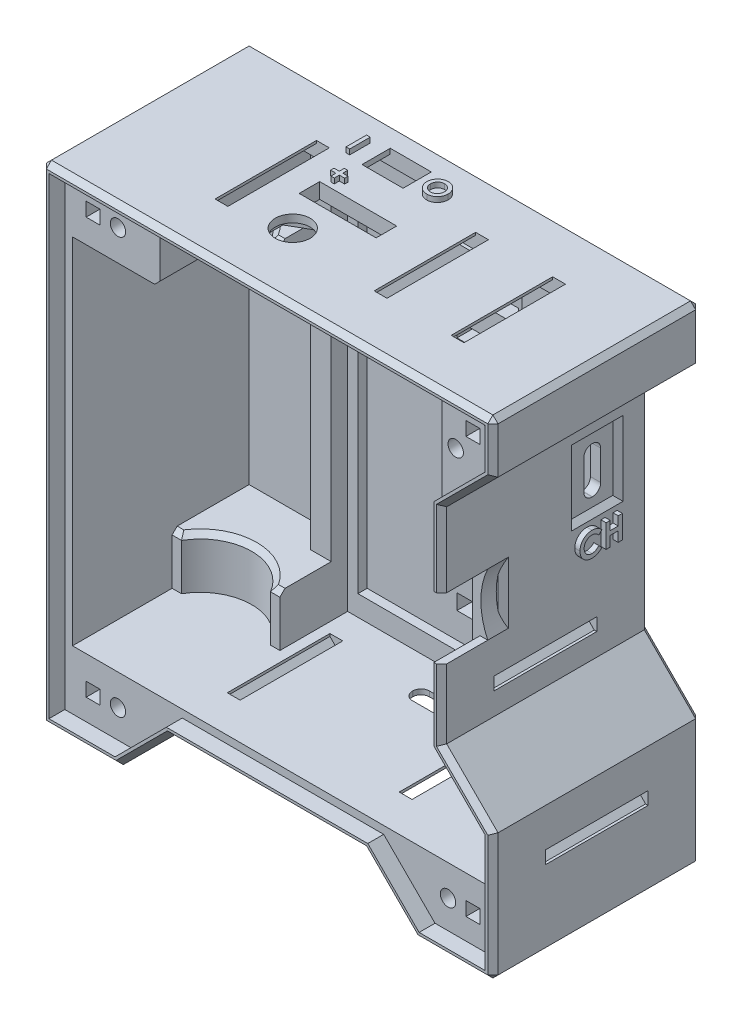
from build123d import *

# Parameters (mm, degrees)
BOSS_EXTRUDE1_DEPTH      = 40.5
CUT_EXTRUDE1_DEPTH       = 37.5
CUT_EXTRUDE2_DEPTH       = 3.1
CUT_EXTRUDE3_DEPTH       = 9
CUT_EXTRUDE4_DEPTH       = 3
SKETCH6_W                = 8
SKETCH6_H                = 12.5
CUT_EXTRUDE5_DEPTH       = 1
SKETCH7_W                = 0.7
SKETCH7_H                = 9
CUT_EXTRUDE6_DEPTH       = 27.25
SKETCH8_W                = 8
SKETCH8_H                = 5.5
SKETCH8_W_2              = 15
SKETCH8_H_2              = 4
CUT_EXTRUDE7_DEPTH       = 3
CHAMFER1_SIZE            = 2
SKETCH9_W                = 17
SKETCH9_H                = 10
BOSS_EXTRUDE2_DEPTH      = 34.4
SKETCH10_W               = 2.7
SKETCH10_H               = 2.7
CUT_EXTRUDE8_DEPTH       = 15
CUT_EXTRUDE9_DEPTH       = 3
SKETCH12_W               = 13
SKETCH12_H               = 7.5
CUT_EXTRUDE10_DEPTH      = 2
SKETCH13_R               = 3.4
CUT_EXTRUDE11_DEPTH      = 3
CUT_EXTRUDE12_DEPTH      = 1.5
CUT_EXTRUDE13_DEPTH      = 3
CHAMFER2_SIZE            = 1
BOSS_EXTRUDE3_DEPTH      = 1.8
SKETCH17_W               = 4
SKETCH17_H               = 79
SKETCH17_W_2             = 3.5
SKETCH17_H_2             = 20.757359313
BOSS_EXTRUDE4_DEPTH      = 5
SKETCH18_W               = 21
SKETCH18_H               = 6
SKETCH18_H_2             = 10
BOSS_EXTRUDE5_DEPTH      = 15
CUT_EXTRUDE14_DEPTH      = 63
CUT_EXTRUDE14_DEPTH_BACK = 6
SKETCH19_R               = 10
SKETCH20_W               = 20
SKETCH20_H               = 5
CUT_EXTRUDE15_DEPTH      = 15
SKETCH21_W               = 5
SKETCH21_H               = 19.763549186
CUT_EXTRUDE16_DEPTH      = 3
SKETCH22_W               = 5
SKETCH22_H               = 20
CUT_EXTRUDE17_DEPTH      = 3
SKETCH24_W               = 20
SKETCH24_H               = 2.5
BOSS_EXTRUDE7_DEPTH      = 1
SKETCH25_W               = 2.5
SKETCH25_H               = 20
BOSS_EXTRUDE8_DEPTH      = 1
SKETCH26_W               = 2.5
SKETCH26_H               = 19.763549186
BOSS_EXTRUDE9_DEPTH      = 1
SKETCH27_W               = 2.5
SKETCH27_H               = 19.763549186
BOSS_EXTRUDE10_DEPTH     = 1
SKETCH28_W               = 2.5
SKETCH28_H               = 20
BOSS_EXTRUDE11_DEPTH     = 1
SKETCH30_W               = 20
SKETCH30_H               = 2.5
BOSS_EXTRUDE13_DEPTH     = 1
CHAMFER3_SIZE            = 0.5
CHAMFER6_SIZE            = 0.5
SKETCH31_W               = 20
SKETCH31_H               = 2.5
BOSS_EXTRUDE14_DEPTH     = 1
SKETCH32_W               = 20
SKETCH32_H               = 2.5
BOSS_EXTRUDE15_DEPTH     = 1
CHAMFER7_SIZE            = 0.5
CHAMFER8_SIZE            = 1.5
SKETCH33_W               = 12
SKETCH33_H               = 3
CUT_EXTRUDE18_DEPTH      = 3
CHAMFER9_SIZE            = 1
SKETCH34_W               = 0.717948718
SKETCH34_H               = 4
BOSS_EXTRUDE16_DEPTH     = 1
BOSS_EXTRUDE17_DEPTH     = 1
BOSS_EXTRUDE18_DEPTH     = 1
BOSS_EXTRUDE19_DEPTH     = 1
SKETCH38_R               = 1.5
CUT_EXTRUDE19_DEPTH      = 21
CHAMFER10_SIZE           = 1
CHAMFER11_SIZE           = 1
CHAMFER12_SIZE           = 1
CHAMFER13_SIZE           = 1
CHAMFER14_SIZE           = 1
SKETCH39_R               = 3
CUT_EXTRUDE20_DEPTH      = 15
SKETCH40_W               = 4
SKETCH40_H               = 10
CUT_EXTRUDE21_DEPTH      = 2
CHAMFER15_SIZE           = 2


# Some blends are built 0.0001 mm under size
with BuildPart() as part:
    # Sketch1 → Boss-Extrude1 (new body)
    with BuildSketch(Plane.XY):
        Polygon((25, 10), (63, 10), (73, 0), (88, 0), (88, 25), (78, 35), (78, 75), (88, 85), (88, 95), (0, 95), (0, 0), (15, 0), align=None)
    extrude(amount=BOSS_EXTRUDE1_DEPTH)

    # Sketch2 → Cut-Extrude1 (cut)
    with BuildSketch(Plane.XY.offset(40.5)):
        Polygon((3, 92), (85, 92), (85, 86.242640687), (75, 76.242640687), (75, 33.757359313), (85, 23.757359313), (85, 3), (74.242640687, 3), (64.242640687, 13), (23.757359313, 13), (13.757359313, 3), (3, 3), align=None)
    extrude(amount=-CUT_EXTRUDE1_DEPTH, mode=Mode.SUBTRACT)

    # Sketch3 → Cut-Extrude2 (cut)
    with BuildSketch(Plane.XY.offset(40.5)):
        Polygon((1.5, 93.5), (86.5, 93.5), (86.5, 85.621320344), (76.5, 75.621320344), (76.5, 34.378679656), (86.5, 24.378679656), (86.5, 1.5), (73.621320344, 1.5), (63.621320344, 11.5), (24.378679656, 11.5), (14.378679656, 1.5), (1.5, 1.5), align=None)
    extrude(amount=-CUT_EXTRUDE2_DEPTH, mode=Mode.SUBTRACT)

    # Sketch4 → Cut-Extrude3 (cut)
    with BuildSketch(Plane.XY.offset(40.5)):
        Polygon((78, 60.5), (76.5, 60.5), (75, 62), (75, 60.5), (75, 47.5), (75, 47), (76.5, 48.5), (78, 48.5), align=None)
    extrude(amount=-CUT_EXTRUDE3_DEPTH, mode=Mode.SUBTRACT)

    # Sketch5 → Cut-Extrude4 (cut)
    with BuildSketch(Plane(origin=(78, 0, 0), x_dir=(0, 0, -1), z_dir=(1, 0, 0))):
        with BuildLine():
            Line((-10.2, 70.5), (-10.1, 70.5))
            ThreePointArc((-10.1, 70.5), (-8.96862915, 70.03137085), (-8.5, 68.9))
            Line((-8.5, 68.9), (-8.5, 63.1))
            ThreePointArc((-8.5, 63.1), (-8.96862915, 61.96862915), (-10.1, 61.5))
            Line((-10.1, 61.5), (-10.2, 61.5))
            ThreePointArc((-10.2, 61.5), (-11.33137085, 61.96862915), (-11.8, 63.1))
            Line((-11.8, 63.1), (-11.8, 68.9))
            ThreePointArc((-11.8, 68.9), (-11.33137085, 70.03137085), (-10.2, 70.5))
        make_face()
    extrude(amount=-CUT_EXTRUDE4_DEPTH, mode=Mode.SUBTRACT)

    # Sketch6 → Cut-Extrude5 (cut)
    with BuildSketch(Plane(origin=(78, 0, 0), x_dir=(0, 0, -1), z_dir=(1, 0, 0))):
        with Locations((-10.15, 66)):
            Rectangle(SKETCH6_W, SKETCH6_H)
    extrude(amount=-CUT_EXTRUDE5_DEPTH, mode=Mode.SUBTRACT)

    # Sketch7 → Cut-Extrude6 (cut)
    with BuildSketch(Plane.XY.offset(37.4)):
        with Locations((75.35, 66)):
            Rectangle(SKETCH7_W, SKETCH7_H)
    extrude(amount=-CUT_EXTRUDE6_DEPTH, mode=Mode.SUBTRACT)

    # Sketch8 → Cut-Extrude7 (cut)
    with BuildSketch(Plane(origin=(0, 95, 0), x_dir=(1, 0, 0), z_dir=(0, 1, 0))):
        with Locations((36, -7.25)):
            Rectangle(SKETCH8_W, SKETCH8_H)
        with Locations((38.25, -19)):
            Rectangle(SKETCH8_W_2, SKETCH8_H_2)
    extrude(amount=-CUT_EXTRUDE7_DEPTH, mode=Mode.SUBTRACT)

    # Chamfer1
    chamfer1_edges = [part.edges().sort_by_distance(p)[0] for p in [
        (32, 92, 7.25),
        (40, 92, 7.25),
        (36, 92, 10),
    ]]
    chamfer(chamfer1_edges, length=CHAMFER1_SIZE)

    # Sketch9 → Boss-Extrude2 (add)
    with BuildSketch(Plane.XY.offset(3)):
        Polygon((75, 76.242640687), (75, 92), (85, 92), (85, 86.242640687), align=None)
        with Locations((11.5, 87)):
            Rectangle(SKETCH9_W, SKETCH9_H)
        Polygon((64.242640687, 13), (85, 13), (85, 3), (74.242640687, 3), align=None)
        Polygon((23.757359313, 13), (3, 13), (3, 3), (13.757359313, 3), align=None)
    extrude(amount=BOSS_EXTRUDE2_DEPTH)

    # Sketch10 → Cut-Extrude8 (cut)
    with BuildSketch(Plane.XY.offset(37.4)):
        with Locations((81, 88)):
            Rectangle(SKETCH10_W, SKETCH10_H)
        with Locations((7, 88)):
            Rectangle(SKETCH10_W, SKETCH10_H)
        with Locations((81, 7)):
            Rectangle(SKETCH10_W, SKETCH10_H)
        with Locations((7, 7)):
            Rectangle(SKETCH10_W, SKETCH10_H)
    extrude(amount=-CUT_EXTRUDE8_DEPTH, mode=Mode.SUBTRACT)

    # Sketch11 → Cut-Extrude9 (cut)
    with BuildSketch(Plane.XZ.offset(-10)):
        with BuildLine():
            Line((45.35, 13.55), (51.15, 13.55))
            ThreePointArc((51.15, 13.55), (52.28137085, 13.08137085), (52.75, 11.95))
            Line((52.75, 11.95), (52.75, 11.85))
            ThreePointArc((52.75, 11.85), (52.28137085, 10.71862915), (51.15, 10.25))
            Line((51.15, 10.25), (45.35, 10.25))
            ThreePointArc((45.35, 10.25), (44.21862915, 10.71862915), (43.75, 11.85))
            Line((43.75, 11.85), (43.75, 11.95))
            ThreePointArc((43.75, 11.95), (44.21862915, 13.08137085), (45.35, 13.55))
        make_face()
    extrude(amount=-CUT_EXTRUDE9_DEPTH, mode=Mode.SUBTRACT)

    # Sketch12 → Cut-Extrude10 (cut)
    with BuildSketch(Plane.XZ.offset(-10)):
        with Locations((48.25, 11.9)):
            Rectangle(SKETCH12_W, SKETCH12_H)
    extrude(amount=-CUT_EXTRUDE10_DEPTH, mode=Mode.SUBTRACT)

    # Sketch13 → Cut-Extrude11 (cut)
    with BuildSketch(Plane(origin=(0, 95, 0), x_dir=(1, 0, 0), z_dir=(0, 1, 0))):
        with Locations(Location((36, -27.5, 0), (0, 0, 270))):
            Circle(SKETCH13_R)
    extrude(amount=-CUT_EXTRUDE11_DEPTH, mode=Mode.SUBTRACT)

    # Sketch14 → Cut-Extrude12 (cut)
    with BuildSketch(Plane.XZ.offset(-92)):
        Polygon((31.5, 24.901923789), (36, 22.303847577), (40.5, 24.901923789), (40.5, 30.098076211), (36, 32.696152423), (31.5, 30.098076211), align=None)
    extrude(amount=-CUT_EXTRUDE12_DEPTH, mode=Mode.SUBTRACT)

    # Sketch15 → Cut-Extrude13 (cut)
    with BuildSketch(Plane.XY.offset(31.5)):
        with BuildLine():
            Line((78, 60.5), (78, 48.5))
            ThreePointArc((78, 48.5), (76.651499661, 54.5), (78, 60.5))
        make_face()
    extrude(amount=-CUT_EXTRUDE13_DEPTH, mode=Mode.SUBTRACT)

    # Chamfer2
    chamfer2_edges = [part.edges().sort_by_distance(p)[0] for p in [
        (78, 54.5, 28.5),
    ]]
    chamfer(chamfer2_edges, length=CHAMFER2_SIZE)

    # Sketch16 → Boss-Extrude3 (add)
    with BuildSketch(Plane.XY.offset(3)):
        Polygon((75, 92), (73, 92), (58, 92), (58, 80), (73, 80), (73, 17), (26, 17), (26, 92), (24, 92), (24, 13), (26, 13), (73, 13), (75, 13), align=None)
    extrude(amount=BOSS_EXTRUDE3_DEPTH)

    # Sketch17 → Boss-Extrude4 (add)
    with BuildSketch(Plane.XY.offset(3)):
        with Locations((22, 52.5)):
            Rectangle(SKETCH17_W, SKETCH17_H)
        with Locations((76.75, 23.378679657)):
            Rectangle(SKETCH17_W_2, SKETCH17_H_2)
    extrude(amount=BOSS_EXTRUDE4_DEPTH)

    # Sketch18 → Boss-Extrude5 (add)
    with BuildSketch(Plane.XY.offset(3)):
        with Locations((13.5, 79)):
            Rectangle(SKETCH18_W, SKETCH18_H)
        with Locations((13.5, 18)):
            Rectangle(SKETCH18_W, SKETCH18_H_2)
    extrude(amount=BOSS_EXTRUDE5_DEPTH)

    # Sketch19 → Cut-Extrude14 (cut, two sides: drawn at the far end of the back side and taken through both)
    with BuildSketch(Plane.XZ.offset(-76).offset(-CUT_EXTRUDE14_DEPTH_BACK)):
        with Locations((13.5, 23)):
            Circle(SKETCH19_R)
    extrude(amount=CUT_EXTRUDE14_DEPTH + CUT_EXTRUDE14_DEPTH_BACK, mode=Mode.SUBTRACT)

    # Sketch20 → Cut-Extrude15 (cut)
    with BuildSketch(Plane(origin=(88, 0, 0), x_dir=(0, 0, -1), z_dir=(1, 0, 0))):
        with Locations((-20.25, 17.5)):
            Rectangle(SKETCH20_W, SKETCH20_H)
        with Locations((-20.25, 41.830736478)):
            Rectangle(SKETCH20_W, SKETCH20_H)
    extrude(amount=-CUT_EXTRUDE15_DEPTH, mode=Mode.SUBTRACT)

    # Sketch21 → Cut-Extrude16 (cut)
    with BuildSketch(Plane(origin=(0, 95, 0), x_dir=(1, 0, 0), z_dir=(0, 1, 0))):
        with Locations((69.5, -20.25)):
            Rectangle(SKETCH21_W, SKETCH21_H)
        with Locations((54.5, -20.25)):
            Rectangle(SKETCH21_W, SKETCH21_H)
        with Locations((23.5, -20.25)):
            Rectangle(SKETCH21_W, SKETCH21_H)
    extrude(amount=-CUT_EXTRUDE16_DEPTH, mode=Mode.SUBTRACT)

    # Sketch22 → Cut-Extrude17 (cut)
    with BuildSketch(Plane.XZ.offset(-10)):
        with Locations((28.5, 20.25)):
            Rectangle(SKETCH22_W, SKETCH22_H)
        with Locations((59.5, 20.25)):
            Rectangle(SKETCH22_W, SKETCH22_H)
    extrude(amount=-CUT_EXTRUDE17_DEPTH, mode=Mode.SUBTRACT)

    # Sketch24 → Boss-Extrude7 (add)
    with BuildSketch(Plane(origin=(88, 0, 0), x_dir=(0, 0, -1), z_dir=(1, 0, 0))):
        with Locations((-20.25, 18.75)):
            Rectangle(SKETCH24_W, SKETCH24_H)
    extrude(amount=-BOSS_EXTRUDE7_DEPTH)

    # Sketch25 → Boss-Extrude8 (add)
    with BuildSketch(Plane.XZ.offset(-10)):
        with Locations((60.75, 20.25)):
            Rectangle(SKETCH25_W, SKETCH25_H)
        with Locations((27.25, 20.25)):
            Rectangle(SKETCH25_W, SKETCH25_H)
    extrude(amount=-BOSS_EXTRUDE8_DEPTH)

    # Sketch26 → Boss-Extrude9 (add)
    with BuildSketch(Plane(origin=(0, 95, 0), x_dir=(1, 0, 0), z_dir=(0, 1, 0))):
        with Locations((22.25, -20.25)):
            Rectangle(SKETCH26_W, SKETCH26_H)
        with Locations((53.25, -20.25)):
            Rectangle(SKETCH26_W, SKETCH26_H)
        with Locations((68.25, -20.25)):
            Rectangle(SKETCH26_W, SKETCH26_H)
    extrude(amount=-BOSS_EXTRUDE9_DEPTH)

    # Sketch27 → Boss-Extrude10 (add)
    with BuildSketch(Plane.XZ.offset(-92)):
        with Locations((24.75, 20.25)):
            Rectangle(SKETCH27_W, SKETCH27_H)
        with Locations((55.75, 20.25)):
            Rectangle(SKETCH27_W, SKETCH27_H)
        with Locations((70.75, 20.25)):
            Rectangle(SKETCH27_W, SKETCH27_H)
    extrude(amount=-BOSS_EXTRUDE10_DEPTH)

    # Sketch28 → Boss-Extrude11 (add)
    with BuildSketch(Plane(origin=(0, 13, 0), x_dir=(1, 0, 0), z_dir=(0, 1, 0))):
        with Locations((29.75, -20.25)):
            Rectangle(SKETCH28_W, SKETCH28_H)
        with Locations((58.25, -20.25)):
            Rectangle(SKETCH28_W, SKETCH28_H)
    extrude(amount=-BOSS_EXTRUDE11_DEPTH)

    # Sketch30 → Boss-Extrude13 (add)
    with BuildSketch(Plane.ZY.offset(-85)):
        with Locations((20.25, 16.25)):
            Rectangle(SKETCH30_W, SKETCH30_H)
    extrude(amount=-BOSS_EXTRUDE13_DEPTH)

    # Chamfer3
    chamfer3_edges = [part.edges().sort_by_distance(p)[0] for p in [
        (54.5, 94, 20.25),
        (69.5, 94, 20.25),
        (54.5, 93, 20.25),
        (69.5, 93, 20.25),
    ]]
    chamfer(chamfer3_edges, length=CHAMFER3_SIZE)

    # Chamfer6
    chamfer6_edges = [part.edges().sort_by_distance(p)[0] for p in [
        (28.5, 11, 20.25),
        (59.5, 11, 20.25),
        (28.5, 12, 20.25),
        (59.5, 12, 20.25),
    ]]
    chamfer(chamfer6_edges, length=CHAMFER6_SIZE)

    # Sketch31 → Boss-Extrude14 (add)
    with BuildSketch(Plane(origin=(78, 0, 0), x_dir=(0, 0, -1), z_dir=(1, 0, 0))):
        with Locations((-20.25, 43.080736478)):
            Rectangle(SKETCH31_W, SKETCH31_H)
    extrude(amount=-BOSS_EXTRUDE14_DEPTH)

    # Sketch32 → Boss-Extrude15 (add)
    with BuildSketch(Plane.ZY.offset(-75)):
        with Locations((20.25, 40.580736478)):
            Rectangle(SKETCH32_W, SKETCH32_H)
    extrude(amount=-BOSS_EXTRUDE15_DEPTH)

    # Chamfer7
    chamfer7_edges = [part.edges().sort_by_distance(p)[0] for p in [
        (87, 17.5, 20.25),
        (23.5, 94, 20.25),
        (23.5, 93, 20.25),
        (86, 17.5, 20.25),
        (77, 41.830736478, 20.25),
        (76, 41.830736478, 20.25),
    ]]
    chamfer(chamfer7_edges, length=CHAMFER7_SIZE)

    # Chamfer8
    chamfer8_edges = [part.edges().sort_by_distance(p)[0] for p in [
        (87, 20, 20.25),
        (26, 11, 20.25),
        (62, 11, 20.25),
        (21, 94, 20.25),
        (52, 94, 20.25),
        (67, 94, 20.25),
        (26, 93, 20.25),
        (57, 93, 20.25),
        (72, 93, 20.25),
        (31, 12, 20.25),
        (57, 12, 20.25),
        (86, 15, 20.25),
        (77, 44.330736478, 20.25),
        (76, 39.330736478, 20.25),
    ]]
    chamfer(chamfer8_edges, length=CHAMFER8_SIZE)

    # Sketch33 → Cut-Extrude18 (cut)
    with BuildSketch(Plane.XY.offset(3)):
        with Locations((49.5, 23.5)):
            Rectangle(SKETCH33_W, SKETCH33_H)
        with Locations((49.5, 31.5)):
            Rectangle(SKETCH33_W, SKETCH33_H)
        with Locations((49.5, 39.5)):
            Rectangle(SKETCH33_W, SKETCH33_H)
        with Locations((49.5, 69.5)):
            Rectangle(SKETCH33_W, SKETCH33_H)
        with Locations((49.5, 77.5)):
            Rectangle(SKETCH33_W, SKETCH33_H)
        with Locations((49.5, 85.5)):
            Rectangle(SKETCH33_W, SKETCH33_H)
    extrude(amount=-CUT_EXTRUDE18_DEPTH, mode=Mode.SUBTRACT)

    # Chamfer9
    chamfer9_edges = [part.edges().sort_by_distance(p)[0] for p in [
        (44, 95, 0),
        (88, 90, 0),
        (20, 5, 40.5),
        (83, 80, 0),
        (78, 55, 0),
        (83, 30, 0),
        (88, 12.5, 0),
        (80.5, 0, 0),
        (68, 5, 0),
        (44, 10, 0),
        (20, 5, 0),
        (7.5, 0, 0),
        (0, 47.5, 0),
        (44, 10, 40.5),
        (78, 67.75, 40.5),
        (0, 95, 20.25),
        (88, 95, 20.25),
        (68, 5, 40.5),
        (88, 0, 20.25),
        (0, 0, 20.25),
        (80.5, 0, 40.5),
        (88, 12.5, 40.5),
        (83, 30, 40.5),
        (78, 41.75, 40.5),
        (83, 80, 40.5),
        (88, 90, 40.5),
        (44, 95, 40.5),
        (0, 47.5, 40.5),
        (7.5, 0, 40.5),
    ]]
    chamfer(chamfer9_edges, length=CHAMFER9_SIZE)

    # Sketch34 → Boss-Extrude16 (add)
    # profile 1 of 2: a face of its own
    with BuildSketch(Plane(origin=(0, 95, 0), x_dir=(1, 0, 0), z_dir=(0, 1, 0))):
        with Locations((28.817356088, -7.57343374)):
            Rectangle(SKETCH34_W, SKETCH34_H)
    # profile 2 of 2: a face of its own
    with BuildSketch(Plane(origin=(0, 95, 0), x_dir=(1, 0, 0), z_dir=(0, 1, 0))):
        with BuildLine():
            add(Edge.make_bspline(
                [(44.28690737, -5.470869638), (44.356452273, -5.47267028), (44.493749661, -5.476225155), (44.695664574, -5.505857815), (44.890246927, -5.554139986), (45.07740873, -5.621255695), (45.256681351, -5.709022778), (45.428697146, -5.81495298), (45.59283996, -5.94104567), (45.747427791, -6.084359314), (45.890294828, -6.240206644), (46.014089199, -6.408004002), (46.119656496, -6.58340359), (46.207150955, -6.766875396), (46.273794271, -6.959690051), (46.320560642, -7.160864453), (46.350605719, -7.370341372), (46.354061365, -7.512966602), (46.355817627, -7.585452971)],
                knots=[0, 0, 0, 0, 1.014329547, 2.002516266, 2.970391464, 3.935626869, 4.897733899, 5.877609409, 6.878433252, 7.912639331, 8.949961323, 9.958554974, 10.949718813, 11.932905612, 12.9188844, 13.919928257, 14.942845884, 16, 16, 16, 16], degree=3))
            add(Edge.make_bspline(
                [(46.355817627, -7.585452971), (46.353947284, -7.657122587), (46.350261713, -7.798349863), (46.321787214, -8.00589637), (46.274233291, -8.204915775), (46.208720298, -8.395858565), (46.122812658, -8.577799878), (46.019304038, -8.751901384), (45.895463041, -8.916547379), (45.755806636, -9.071649508), (45.602057054, -9.212437971), (45.439211839, -9.336507561), (45.268022909, -9.44163945), (45.088740832, -9.527785481), (44.900981144, -9.594640244), (44.705207636, -9.641811136), (44.501432422, -9.670477841), (44.362855394, -9.674139337), (44.292516345, -9.675997843)],
                knots=[0, 0, 0, 0, 1.051557043, 2.072126891, 3.067553643, 4.050577992, 5.02905126, 6.015227836, 7.017913613, 8.04756643, 9.074058332, 10.072836633, 11.047628519, 12.017157415, 12.98668631, 13.966869689, 14.968021931, 16, 16, 16, 16], degree=3))
            add(Edge.make_bspline(
                [(44.292516345, -9.675997843), (44.218950133, -9.674330672), (44.074402582, -9.671054908), (43.862856595, -9.639903892), (43.66017726, -9.592979579), (43.468067201, -9.52294756), (43.28456994, -9.435401647), (43.111033687, -9.327583607), (42.94751676, -9.199671617), (42.794957119, -9.054941551), (42.656737715, -8.896575114), (42.534731979, -8.729275018), (42.431817435, -8.554319287), (42.347990316, -8.371626039), (42.281904383, -8.182330667), (42.235288265, -7.985280309), (42.207751013, -7.780947563), (42.203915233, -7.642160677), (42.201971473, -7.571831176)],
                knots=[0, 0, 0, 0, 1.067978421, 2.098431617, 3.099715153, 4.085208694, 5.062210972, 6.048429807, 7.046490867, 8.072918869, 9.098532598, 10.095778865, 11.076610158, 12.041847152, 13.011192615, 13.984257998, 14.978533688, 16, 16, 16, 16], degree=3))
            add(Edge.make_bspline(
                [(42.201971473, -7.571831176), (42.202581537, -7.52451717), (42.20379394, -7.430488261), (42.218398613, -7.291142218), (42.239425144, -7.154516023), (42.270522385, -7.021154406), (42.308297584, -6.890116563), (42.357240691, -6.762622227), (42.412951192, -6.637309407), (42.478043668, -6.515658206), (42.550420206, -6.398787915), (42.629389454, -6.287249832), (42.715149977, -6.182392617), (42.807425513, -6.083527189), (42.906534056, -5.991303399), (43.011171936, -5.904415692), (43.123368518, -5.825172112), (43.24066817, -5.751637375), (43.362409585, -5.685141187), (43.488097164, -5.62854162), (43.615141496, -5.579114183), (43.74523972, -5.540103864), (43.876997603, -5.508330367), (44.011822711, -5.487318009), (44.148496976, -5.47271374), (44.24066108, -5.471485797), (44.28690737, -5.470869638)],
                knots=[0, 0, 0, 0, 1.034744296, 2.056386356, 3.06226378, 4.057406941, 5.050368692, 6.043467995, 7.042652155, 8.049140477, 9.059438543, 10.048523776, 11.036952808, 12.020949711, 13.004946614, 13.997082645, 14.994316842, 16.007702937, 17.024872941, 18.026463647, 19.021641123, 20.005082605, 20.995858141, 21.984425357, 22.988620895, 24, 24, 24, 24], degree=3))
        make_face()
        with BuildLine():
            add(Edge.make_bspline(
                [(44.275689422, -6.188818356), (44.228885712, -6.190074204), (44.136513917, -6.192552747), (44.001021317, -6.21143589), (43.870943636, -6.241594415), (43.747001946, -6.28527867), (43.628659073, -6.34087764), (43.515705232, -6.408197054), (43.4097046, -6.489550944), (43.309243761, -6.58057178), (43.218493924, -6.681989909), (43.13831358, -6.790676683), (43.071215547, -6.906450596), (43.015020523, -7.028236136), (42.972718125, -7.157402748), (42.942587396, -7.292938658), (42.923545899, -7.4350774), (42.921145695, -7.531973195), (42.919920191, -7.581446561)],
                knots=[0, 0, 0, 0, 1.033739768, 2.040188636, 3.016340934, 3.979330865, 4.937572243, 5.900995986, 6.878200029, 7.884839167, 8.891893314, 9.879764717, 10.863503415, 11.843163062, 12.837761627, 13.859916423, 14.907309254, 16, 16, 16, 16], degree=3))
            add(Edge.make_bspline(
                [(42.919920191, -7.581446561), (42.921545022, -7.63627418), (42.924729422, -7.743727228), (42.947135248, -7.900476839), (42.985469385, -8.04851129), (43.040823133, -8.187106566), (43.109476304, -8.317801663), (43.194732646, -8.438994727), (43.295211411, -8.551411407), (43.372619436, -8.617044946), (43.41190737, -8.650356817)],
                knots=[0, 0, 0, 0, 1.078454662, 2.113592447, 3.107694534, 4.079536787, 5.043276885, 6.005368276, 6.987637804, 8, 8, 8, 8], degree=3))
            add(Edge.make_bspline(
                [(43.41190737, -8.650356817), (43.444091689, -8.674966348), (43.507735207, -8.723630953), (43.609324119, -8.786004627), (43.713940694, -8.839465088), (43.822374396, -8.882660508), (43.934396219, -8.916637299), (44.0499908, -8.940430688), (44.168994352, -8.955363096), (44.249470131, -8.957147802), (44.290112498, -8.958049125)],
                knots=[0, 0, 0, 0, 1.023928204, 2.024787132, 3.009472467, 3.9914905, 4.972207045, 5.96565515, 6.972602802, 8, 8, 8, 8], degree=3))
            add(Edge.make_bspline(
                [(44.290112498, -8.958049125), (44.336111418, -8.956782628), (44.426615738, -8.954290756), (44.55958607, -8.935640075), (44.686975686, -8.904076389), (44.809575433, -8.860775348), (44.927031788, -8.804478285), (45.038770708, -8.735070833), (45.144988103, -8.653405227), (45.245320957, -8.561189088), (45.337029928, -8.459371441), (45.417042952, -8.350104943), (45.486274367, -8.235797062), (45.541300814, -8.114829944), (45.585274484, -7.988345461), (45.615042575, -7.855783441), (45.634244929, -7.717690354), (45.63664581, -7.623713129), (45.637868909, -7.575837587)],
                knots=[0, 0, 0, 0, 1.026359118, 2.019393844, 2.989460624, 3.950973911, 4.916101784, 5.890408035, 6.881132271, 7.902007068, 8.92769091, 9.933912415, 10.920395702, 11.90457117, 12.894218921, 13.903490204, 14.931958862, 16, 16, 16, 16], degree=3))
            add(Edge.make_bspline(
                [(45.637868909, -7.575837587), (45.63660349, -7.528237342), (45.634112707, -7.43454352), (45.6154292, -7.29680547), (45.584065683, -7.164828672), (45.540634613, -7.038397595), (45.485175437, -6.917388288), (45.416594539, -6.802226293), (45.335132561, -6.693022942), (45.242664347, -6.590522415), (45.142018379, -6.496330996), (45.033964875, -6.414589967), (44.921527295, -6.343559611), (44.802125772, -6.287917299), (44.67820316, -6.243587187), (44.549003277, -6.210941856), (44.414036772, -6.192685402), (44.322216267, -6.190118861), (44.275689422, -6.188818356)],
                knots=[0, 0, 0, 0, 1.055025985, 2.07665775, 3.074803781, 4.057872707, 5.035505728, 6.020516407, 7.023567878, 8.050795229, 9.077271434, 10.074415901, 11.050397877, 12.019801805, 12.988065821, 13.964604439, 14.968634123, 16, 16, 16, 16], degree=3))
        make_face(mode=Mode.SUBTRACT)
    extrude(amount=BOSS_EXTRUDE16_DEPTH)

    # Sketch35 → Boss-Extrude17 (add)
    with BuildSketch(Plane(origin=(78, 0, 0), x_dir=(0, 0, -1), z_dir=(1, 0, 0))):
        with BuildLine():
            Line((-10.262415949, 57.004453344), (-10.854663546, 56.438347575))
            add(Edge.make_bspline(
                [(-10.854663546, 56.438347575), (-10.904902812, 56.49029506), (-11.003035838, 56.591764773), (-11.161165073, 56.726101732), (-11.325613719, 56.83805341), (-11.493182758, 56.932338401), (-11.666886269, 57.003671716), (-11.844715768, 57.055653504), (-12.027806748, 57.087344836), (-12.15171568, 57.090970885), (-12.214038546, 57.09279469)],
                knots=[0, 0, 0, 0, 1.115251505, 2.178435587, 3.19620269, 4.182487026, 5.141301733, 6.088180966, 7.038406374, 8, 8, 8, 8], degree=3))
            add(Edge.make_bspline(
                [(-12.214038546, 57.09279469), (-12.266085712, 57.09135382), (-12.36879506, 57.088510422), (-12.519599298, 57.067665509), (-12.663851345, 57.032217827), (-12.802044999, 56.983364355), (-12.933773619, 56.920150556), (-13.059313391, 56.842625354), (-13.178354802, 56.751488913), (-13.289325383, 56.647212778), (-13.390837371, 56.533283263), (-13.480529675, 56.411720743), (-13.555661368, 56.282803711), (-13.617320726, 56.147837742), (-13.665350983, 56.006198149), (-13.69965062, 55.857980287), (-13.719488614, 55.703007642), (-13.722449567, 55.597658393), (-13.723954411, 55.544116805)],
                knots=[0, 0, 0, 0, 1.035432265, 2.043311493, 3.022114605, 3.98653278, 4.95457646, 5.923598177, 6.917315552, 7.932509744, 8.948865224, 9.949768934, 10.933144597, 11.912367597, 12.897413939, 13.903909035, 14.934704909, 16, 16, 16, 16], degree=3))
            add(Edge.make_bspline(
                [(-13.723954411, 55.544116805), (-13.723520732, 55.506537573), (-13.722665942, 55.432468134), (-13.713308756, 55.322898876), (-13.698241481, 55.216590793), (-13.676435399, 55.113704912), (-13.649166681, 55.014152072), (-13.617174264, 54.917073436), (-13.577040249, 54.823810412), (-13.532490886, 54.73327981), (-13.48068049, 54.647951871), (-13.424819326, 54.5665846), (-13.364247014, 54.48957685), (-13.298571223, 54.417243433), (-13.226867648, 54.350714756), (-13.150989562, 54.287990225), (-13.069657007, 54.230640045), (-12.984559464, 54.177224952), (-12.8949618, 54.130822806), (-12.803295007, 54.088791426), (-12.708169231, 54.054655697), (-12.610742686, 54.027139185), (-12.511363539, 54.003740501), (-12.409059771, 53.989333212), (-12.304718228, 53.978422741), (-12.234200858, 53.977749083), (-12.198714026, 53.977410075)],
                knots=[0, 0, 0, 0, 1.103660481, 2.175337485, 3.227646561, 4.255952547, 5.262355991, 6.258840057, 7.255597736, 8.242457506, 9.22035537, 10.185017736, 11.140346927, 12.096287581, 13.051739095, 14.01125915, 14.986044842, 15.97314143, 16.960198552, 17.947847494, 18.933482797, 19.925264591, 20.920966487, 21.929612487, 22.958107872, 24, 24, 24, 24], degree=3))
            add(Edge.make_bspline(
                [(-12.198714026, 53.977410075), (-12.138522262, 53.97915114), (-12.020261096, 53.98257188), (-11.846695832, 54.009321587), (-11.681305426, 54.053323339), (-11.549159284, 54.105286853), (-11.445626271, 54.156601497), (-11.366808119, 54.204065016), (-11.285304007, 54.257158173), (-11.202467649, 54.317884761), (-11.117367299, 54.385516038), (-11.031505175, 54.461533253), (-10.942683192, 54.54343327), (-10.884496791, 54.601886921), (-10.854663546, 54.63185719)],
                knots=[0, 0, 0, 0, 1.404581149, 2.759636711, 4.088442092, 5.392261763, 6.066678138, 6.783632037, 7.538459478, 8.336747902, 9.180226004, 10.074962426, 11.012997595, 12, 12, 12, 12], degree=3))
            Line((-10.854663546, 54.63185719), (-10.280444796, 54.028792286))
            add(Edge.make_bspline(
                [(-10.280444796, 54.028792286), (-10.320809283, 53.989821641), (-10.39959213, 53.913759275), (-10.518433868, 53.805757814), (-10.637126038, 53.708706495), (-10.752801287, 53.619082781), (-10.867354493, 53.539497628), (-10.98077351, 53.469871553), (-11.091774385, 53.408443613), (-11.202662086, 53.356249759), (-11.314126614, 53.311931757), (-11.428810514, 53.273776866), (-11.547064386, 53.2414992), (-11.669610471, 53.215455363), (-11.795305733, 53.194571722), (-11.925326513, 53.180475385), (-12.058848416, 53.170998887), (-12.149418391, 53.170147345), (-12.195108257, 53.169717767)],
                knots=[0, 0, 0, 0, 1.244526981, 2.429050516, 3.560637417, 4.644440555, 5.67424972, 6.652764056, 7.595344123, 8.486817594, 9.369275933, 10.254498637, 11.166417451, 12.086725134, 13.032340136, 13.991389299, 14.986715468, 16, 16, 16, 16], degree=3))
            add(Edge.make_bspline(
                [(-12.195108257, 53.169717767), (-12.279034882, 53.171857224), (-12.443255959, 53.176043547), (-12.683917664, 53.207061364), (-12.912539825, 53.259062188), (-13.129678634, 53.332605696), (-13.335265048, 53.426554081), (-13.529246472, 53.541730389), (-13.711310249, 53.677828616), (-13.879985663, 53.833253558), (-14.032560603, 54.004907358), (-14.167419181, 54.189216447), (-14.278974202, 54.387086638), (-14.37160074, 54.595594756), (-14.444033474, 54.815692304), (-14.495013839, 55.04761736), (-14.526453059, 55.291145986), (-14.529892554, 55.457481652), (-14.531646719, 55.542313921)],
                knots=[0, 0, 0, 0, 1.078019885, 2.10938526, 3.111377082, 4.085535484, 5.04941344, 6.010039228, 6.978205633, 7.964457913, 8.951525778, 9.924444315, 10.892603023, 11.863865945, 12.85144698, 13.863884204, 14.910567087, 16, 16, 16, 16], degree=3))
            add(Edge.make_bspline(
                [(-14.531646719, 55.542313921), (-14.530905494, 55.597640803), (-14.529436567, 55.70728516), (-14.513998009, 55.868800182), (-14.492475761, 56.026248437), (-14.458332672, 56.177995092), (-14.417176546, 56.326084453), (-14.365993496, 56.468906962), (-14.304865268, 56.606873106), (-14.23576217, 56.740213847), (-14.157586526, 56.868055662), (-14.070255749, 56.989300188), (-13.976018075, 57.104883409), (-13.872609125, 57.213271901), (-13.761531568, 57.315417334), (-13.6422839, 57.410766164), (-13.515583336, 57.5006858), (-13.381086946, 57.582857434), (-13.241407636, 57.657186043), (-13.09830713, 57.722747052), (-12.952137009, 57.777540957), (-12.803515293, 57.82299048), (-12.651814057, 57.856915336), (-12.498116107, 57.882595357), (-12.341113658, 57.896950653), (-12.235700114, 57.899300706), (-12.182488065, 57.900486998)],
                knots=[0, 0, 0, 0, 1.071919942, 2.124283339, 3.142214191, 4.149696895, 5.136002878, 6.119640489, 7.086990633, 8.058538607, 9.028339693, 9.988281803, 10.952401235, 11.916291999, 12.888973767, 13.874849856, 14.873389453, 15.898127285, 16.927174885, 17.938320013, 18.946391617, 19.950418109, 20.947802303, 21.956882652, 22.968648068, 24, 24, 24, 24], degree=3))
            add(Edge.make_bspline(
                [(-12.182488065, 57.900486998), (-12.137092731, 57.899806986), (-12.046774047, 57.898454033), (-11.912274371, 57.887175695), (-11.778850361, 57.86946318), (-11.646979715, 57.842738766), (-11.515719159, 57.81101351), (-11.386793605, 57.769473663), (-11.258169183, 57.723169675), (-11.131863174, 57.667822713), (-11.007699275, 57.607406504), (-10.88858622, 57.538862121), (-10.772524113, 57.466407709), (-10.662084819, 57.385755097), (-10.555199574, 57.299829707), (-10.452427288, 57.208230648), (-10.35466985, 57.109430695), (-10.29332271, 57.039622696), (-10.262415949, 57.004453344)],
                knots=[0, 0, 0, 0, 0.996412454, 1.982464992, 2.961075852, 3.949442424, 4.934965278, 5.923860011, 6.921385422, 7.934793307, 8.949617135, 9.951082467, 10.950285876, 11.951772932, 12.951063433, 13.960125323, 14.972308753, 16, 16, 16, 16], degree=3))
        make_face()
        Polygon((-9.454723642, 57.785102382), (-8.647031334, 57.785102382), (-8.647031334, 56.054333152), (-7.089339026, 56.054333152), (-7.089339026, 57.785102382), (-6.281646719, 57.785102382), (-6.281646719, 53.285102382), (-7.089339026, 53.285102382), (-7.089339026, 55.246640844), (-8.647031334, 55.246640844), (-8.647031334, 53.285102382), (-9.454723642, 53.285102382), align=None)
    extrude(amount=BOSS_EXTRUDE17_DEPTH)

    # Sketch36 → Boss-Extrude18 (add)
    with BuildSketch(Plane(origin=(0, 95, 0), x_dir=(1, 0, 0), z_dir=(0, 1, 0))):
        Polygon((31.90912764, -14.331651299), (31.90912764, -13.357292325), (32.575794306, -13.357292325), (32.575794306, -14.331651299), (33.601435332, -14.331651299), (33.601435332, -14.998317966), (32.575794306, -14.998317966), (32.575794306, -15.97267694), (31.90912764, -15.97267694), (31.90912764, -14.998317966), (30.883486614, -14.998317966), (30.883486614, -14.331651299), align=None)
    extrude(amount=BOSS_EXTRUDE18_DEPTH)

    # Sketch37 → Boss-Extrude19 (add)
    # profile 1 of 2: a face of its own
    with BuildSketch(Plane.XZ.offset(-10)):
        with BuildLine():
            Line((44.782448013, 22.160822962), (45.583730064, 22.160822962))
            add(Edge.make_bspline(
                [(45.583730064, 22.160822962), (45.636084794, 22.160588611), (45.737088042, 22.160136499), (45.882743035, 22.154654039), (46.017116898, 22.144829137), (46.140178759, 22.132687112), (46.251878017, 22.115664465), (46.352354553, 22.096149334), (46.44162922, 22.072374223), (46.52070872, 22.044153497), (46.591680018, 22.010882364), (46.658841756, 21.975446232), (46.720676071, 21.933154458), (46.780303929, 21.88856507), (46.834316301, 21.837418461), (46.886082804, 21.783118512), (46.933410983, 21.723511731), (46.976520142, 21.659319644), (47.015626791, 21.591728244), (47.049792976, 21.520616699), (47.077506672, 21.445872482), (47.100755017, 21.367979103), (47.119428314, 21.286939957), (47.131857855, 21.202256646), (47.140300625, 21.11452046), (47.141045583, 21.054807158), (47.141422372, 21.024605013)],
                knots=[0, 0, 0, 0, 1.698747864, 3.27724071, 4.728299578, 6.070144658, 7.288476769, 8.393259625, 9.389771311, 10.283485332, 11.113357557, 11.931608583, 12.74405601, 13.541433047, 14.344816069, 15.154114104, 15.974336324, 16.810834471, 17.661136416, 18.50621059, 19.367396281, 20.244825668, 21.142564693, 22.063065223, 23.020325768, 24, 24, 24, 24], degree=3))
            add(Edge.make_bspline(
                [(47.141422372, 21.024605013), (47.140877205, 20.991193099), (47.139805886, 20.925534584), (47.129303501, 20.829287255), (47.111362111, 20.737524141), (47.087913651, 20.649471387), (47.055216443, 20.566577657), (47.017861417, 20.486865079), (46.971902887, 20.412568551), (46.919387919, 20.342758712), (46.862035583, 20.276867975), (46.798484337, 20.216798811), (46.729945495, 20.16214173), (46.656815803, 20.112323922), (46.578820711, 20.06744588), (46.496016497, 20.02708737), (46.407837726, 19.992539181), (46.346432682, 19.974470758), (46.315300577, 19.965310141)],
                knots=[0, 0, 0, 0, 1.102006807, 2.165578795, 3.188629044, 4.184801286, 5.166646146, 6.124351954, 7.085497154, 8.042432466, 9.003981491, 9.963833307, 10.922997304, 11.89326795, 12.880200226, 13.889073926, 14.929769137, 16, 16, 16, 16], degree=3))
            add(Edge.make_bspline(
                [(46.315300577, 19.965310141), (46.294795182, 19.960208366), (46.250373892, 19.949156277), (46.176868859, 19.937935633), (46.092162026, 19.927618941), (45.995979481, 19.918752993), (45.888265772, 19.912726214), (45.769125193, 19.908019568), (45.638503754, 19.90459735), (45.54767477, 19.904475914), (45.500396731, 19.904412705)],
                knots=[0, 0, 0, 0, 0.618981996, 1.340914327, 2.176866532, 3.120127938, 4.170906482, 5.338178032, 6.614476169, 8, 8, 8, 8], degree=3))
            Line((45.500396731, 19.904412705), (45.500396731, 18.160822962))
            Line((45.500396731, 18.160822962), (44.782448013, 18.160822962))
            Line((44.782448013, 18.160822962), (44.782448013, 22.160822962))
        make_face()
        with BuildLine():
            Line((45.500396731, 20.622361423), (45.754403141, 20.622361423))
            add(Edge.make_bspline(
                [(45.754403141, 20.622361423), (45.800623618, 20.622654497), (45.885669981, 20.623193757), (46.001813281, 20.630991769), (46.095148271, 20.642900909), (46.168884646, 20.65998137), (46.227106498, 20.685903232), (46.277319201, 20.715889944), (46.320387918, 20.753807318), (46.357679087, 20.797134406), (46.387492254, 20.846919402), (46.408166132, 20.902351653), (46.421595477, 20.962266469), (46.422835801, 21.003963216), (46.423473654, 21.025406295)],
                knots=[0, 0, 0, 0, 1.8619151, 3.425951444, 4.686033666, 5.651700536, 6.461346321, 7.243864085, 7.999046032, 8.762387399, 9.539336099, 10.322741239, 11.137448474, 12, 12, 12, 12], degree=3))
            add(Edge.make_bspline(
                [(46.423473654, 21.025406295), (46.422842363, 21.044140834), (46.421617505, 21.080490344), (46.41261937, 21.132951703), (46.398278932, 21.181856512), (46.377500187, 21.226694024), (46.350638191, 21.267388055), (46.317887982, 21.303922572), (46.279669809, 21.337079995), (46.250163145, 21.354630725), (46.235172372, 21.363547321)],
                knots=[0, 0, 0, 0, 1.102301479, 2.1387299, 3.123554645, 4.094223062, 5.036071848, 5.982632524, 6.975082478, 8, 8, 8, 8], degree=3))
            add(Edge.make_bspline(
                [(46.235172372, 21.363547321), (46.222474322, 21.369969088), (46.195589949, 21.383565287), (46.149803255, 21.399371862), (46.096966109, 21.412706449), (46.036721801, 21.423774028), (45.969310662, 21.432363618), (45.894744721, 21.438932506), (45.812914247, 21.441574111), (45.756006048, 21.442428913), (45.726358269, 21.442874244)],
                knots=[0, 0, 0, 0, 0.656809284, 1.390599849, 2.23162475, 3.173112763, 4.218524733, 5.370385145, 6.63003504, 8, 8, 8, 8], degree=3))
            Line((45.726358269, 21.442874244), (45.500396731, 21.442874244))
            Line((45.500396731, 21.442874244), (45.500396731, 20.622361423))
        make_face(mode=Mode.SUBTRACT)
    # profile 2 of 2: a face of its own
    with BuildSketch(Plane.XZ.offset(-10)):
        with BuildLine():
            Line((51.44911468, 21.466912705), (50.922672372, 20.963707577))
            add(Edge.make_bspline(
                [(50.922672372, 20.963707577), (50.878015247, 21.009883119), (50.79078589, 21.10007842), (50.65022657, 21.21948905), (50.504049995, 21.319001653), (50.355099739, 21.402810533), (50.200696618, 21.466217925), (50.042625952, 21.512423959), (49.879878415, 21.540594031), (49.769737141, 21.543817186), (49.714339039, 21.545438346)],
                knots=[0, 0, 0, 0, 1.115251505, 2.178435587, 3.19620269, 4.182487026, 5.141301733, 6.088180966, 7.038406374, 8, 8, 8, 8], degree=3))
            add(Edge.make_bspline(
                [(49.714339039, 21.545438346), (49.668074891, 21.544157573), (49.576777693, 21.541630108), (49.442729481, 21.523101296), (49.314505439, 21.491592246), (49.191666636, 21.448166938), (49.074574529, 21.391976893), (48.96298362, 21.323065603), (48.857169033, 21.242055434), (48.758528516, 21.149365535), (48.668295639, 21.048094856), (48.588569145, 20.940039283), (48.521785419, 20.825446365), (48.4669771, 20.705476615), (48.424283539, 20.579574754), (48.393794972, 20.447825544), (48.3761612, 20.310072082), (48.373529242, 20.216428305), (48.372191603, 20.168835782)],
                knots=[0, 0, 0, 0, 1.035432265, 2.043311493, 3.022114605, 3.98653278, 4.95457646, 5.923598177, 6.917315552, 7.932509744, 8.948865224, 9.949768934, 10.933144597, 11.912367597, 12.897413939, 13.903909035, 14.934704909, 16, 16, 16, 16], degree=3))
            add(Edge.make_bspline(
                [(48.372191603, 20.168835782), (48.372577095, 20.13543202), (48.373336908, 20.069592519), (48.381654407, 19.972197623), (48.395047541, 19.877701549), (48.414430724, 19.786247432), (48.438669585, 19.697756019), (48.467107289, 19.611463898), (48.502781969, 19.528563432), (48.542381403, 19.448091786), (48.588435088, 19.372244729), (48.638089456, 19.299918266), (48.691931511, 19.231466933), (48.750309992, 19.167170562), (48.814046503, 19.108033961), (48.88149369, 19.052278821), (48.953789296, 19.001300884), (49.029431555, 18.953820801), (49.109073923, 18.912574449), (49.190555517, 18.875213223), (49.275111763, 18.844870352), (49.361713136, 18.820411231), (49.450050155, 18.7996124), (49.540986838, 18.786805921), (49.633734877, 18.777107725), (49.696416983, 18.776508918), (49.727960833, 18.776207577)],
                knots=[0, 0, 0, 0, 1.103660481, 2.175337485, 3.227646561, 4.255952547, 5.262355991, 6.258840057, 7.255597736, 8.242457506, 9.22035537, 10.185017736, 11.140346927, 12.096287581, 13.051739095, 14.01125915, 14.986044842, 15.97314143, 16.960198552, 17.947847494, 18.933482797, 19.925264591, 20.920966487, 21.929612487, 22.958107872, 24, 24, 24, 24], degree=3))
            add(Edge.make_bspline(
                [(49.727960833, 18.776207577), (49.781464624, 18.777755191), (49.88658566, 18.780795849), (50.040865895, 18.804573365), (50.187879589, 18.843686035), (50.305342827, 18.889875824), (50.397372171, 18.935488841), (50.467432751, 18.977678636), (50.53988085, 19.024872553), (50.613513169, 19.078851743), (50.689157925, 19.138968433), (50.765479812, 19.206539291), (50.844432687, 19.279339306), (50.896153932, 19.331298107), (50.922672372, 19.357938346)],
                knots=[0, 0, 0, 0, 1.404581149, 2.759636711, 4.088442092, 5.392261763, 6.066678138, 6.783632037, 7.538459478, 8.336747902, 9.180226004, 10.074962426, 11.012997595, 12, 12, 12, 12], degree=3))
            Line((50.922672372, 19.357938346), (51.433089039, 18.821880654))
            add(Edge.make_bspline(
                [(51.433089039, 18.821880654), (51.397209494, 18.78724008), (51.327180297, 18.719629089), (51.221543197, 18.62362779), (51.116039045, 18.537359951), (51.013216602, 18.457694427), (50.91139153, 18.386952068), (50.810574625, 18.325062224), (50.711907181, 18.270459611), (50.613340336, 18.224065075), (50.514260756, 18.184671295), (50.412319511, 18.150755836), (50.307204958, 18.122064577), (50.198275105, 18.0989145), (50.086545983, 18.080351264), (49.970971956, 18.067821186), (49.852285821, 18.059397632), (49.771779176, 18.058640706), (49.731165962, 18.058258859)],
                knots=[0, 0, 0, 0, 1.244526981, 2.429050516, 3.560637417, 4.644440555, 5.67424972, 6.652764056, 7.595344123, 8.486817594, 9.369275933, 10.254498637, 11.166417451, 12.086725134, 13.032340136, 13.991389299, 14.986715468, 16, 16, 16, 16], degree=3))
            add(Edge.make_bspline(
                [(49.731165962, 18.058258859), (49.656564517, 18.060160599), (49.510590227, 18.063881774), (49.296668711, 18.091453167), (49.093449013, 18.137676122), (48.900436738, 18.203048129), (48.717693258, 18.286557805), (48.545265327, 18.388936746), (48.383430858, 18.509912947), (48.233497156, 18.648068451), (48.097874987, 18.800649606), (47.978000696, 18.964479908), (47.878840677, 19.140364523), (47.796505977, 19.325705072), (47.732121325, 19.521347336), (47.686805444, 19.727502942), (47.658859472, 19.943972832), (47.655802142, 20.091826757), (47.654242885, 20.167233218)],
                knots=[0, 0, 0, 0, 1.078019885, 2.10938526, 3.111377082, 4.085535484, 5.04941344, 6.010039228, 6.978205633, 7.964457913, 8.951525778, 9.924444315, 10.892603023, 11.863865945, 12.85144698, 13.863884204, 14.910567087, 16, 16, 16, 16], degree=3))
            add(Edge.make_bspline(
                [(47.654242885, 20.167233218), (47.654901751, 20.216412669), (47.656207464, 20.31387432), (47.669930627, 20.457443228), (47.689061514, 20.597397232), (47.719410926, 20.732283148), (47.755994149, 20.863918135), (47.801490194, 20.990871477), (47.855826396, 21.113508049), (47.917251373, 21.232033153), (47.986740834, 21.345670321), (48.064368191, 21.453443233), (48.148135013, 21.556183874), (48.240054079, 21.6525292), (48.338789686, 21.743325141), (48.444787613, 21.828079657), (48.557410336, 21.908008222), (48.676962682, 21.981049674), (48.801122069, 22.047119549), (48.928322519, 22.105396001), (49.058251516, 22.154101695), (49.190359708, 22.194501271), (49.325205251, 22.224656698), (49.46182565, 22.247483383), (49.601383383, 22.260243647), (49.695084311, 22.262332583), (49.74238391, 22.263387064)],
                knots=[0, 0, 0, 0, 1.071919942, 2.124283339, 3.142214191, 4.149696895, 5.136002878, 6.119640489, 7.086990633, 8.058538607, 9.028339693, 9.988281803, 10.952401235, 11.916291999, 12.888973767, 13.874849856, 14.873389453, 15.898127285, 16.927174885, 17.938320013, 18.946391617, 19.950418109, 20.947802303, 21.956882652, 22.968648068, 24, 24, 24, 24], degree=3))
            add(Edge.make_bspline(
                [(49.74238391, 22.263387064), (49.782735319, 22.262782609), (49.863018593, 22.261579984), (49.98257386, 22.251554795), (50.101172981, 22.235810337), (50.218391333, 22.212055303), (50.335067382, 22.183855075), (50.449667874, 22.146930767), (50.564000695, 22.105771667), (50.676272702, 22.056574367), (50.786640613, 22.00287107), (50.892518883, 21.941942729), (50.995685201, 21.877538807), (51.093853462, 21.805847597), (51.188862569, 21.729469473), (51.280215712, 21.648048087), (51.367111212, 21.560225906), (51.421642003, 21.498174351), (51.44911468, 21.466912705)],
                knots=[0, 0, 0, 0, 0.996412454, 1.982464992, 2.961075852, 3.949442424, 4.934965278, 5.923860011, 6.921385422, 7.934793307, 8.949617135, 9.951082467, 10.950285876, 11.951772932, 12.951063433, 13.960125323, 14.972308753, 16, 16, 16, 16], degree=3))
        make_face()
    extrude(amount=BOSS_EXTRUDE19_DEPTH)

    # Sketch38 → Cut-Extrude19 (cut)
    with BuildSketch(Plane.XY.offset(37.4)):
        with Locations((11.85, 88)):
            Circle(SKETCH38_R)
        with Locations((77.65, 83.65)):
            Circle(SKETCH38_R)
        with Locations((76.15, 7)):
            Circle(SKETCH38_R)
        with Locations((11.85, 7)):
            Circle(SKETCH38_R)
        with Locations((84.35, 91.35)):
            Circle(SKETCH38_R)
    extrude(amount=-CUT_EXTRUDE19_DEPTH, mode=Mode.SUBTRACT)

    # Chamfer10
    chamfer10_edges = [part.edges().sort_by_distance(p)[0] for p in [
        (20, 82, 26.400328962),
    ]]
    chamfer(chamfer10_edges, length=CHAMFER10_SIZE)

    # Chamfer11
    chamfer11_edges = [part.edges().sort_by_distance(p)[0] for p in [
        (3.919872981, 76, 18),
        (23.080127019, 82, 18),
        (23.080127019, 23, 18),
        (23.080127019, 76, 18),
        (3.919872981, 23, 18),
        (13.5, 23, 13),
        (13.5, 76, 13),
        (21.190739264, 82, 16.608401642),
    ]]
    chamfer(chamfer11_edges, length=CHAMFER11_SIZE)

    # Chamfer12
    chamfer12_edges = [part.edges().sort_by_distance(p)[0] for p in [
        (78, 72.25, 10.15),
        (78, 66, 14.15),
        (78, 59.75, 10.15),
        (78, 66, 6.15),
    ]]
    chamfer(chamfer12_edges, length=CHAMFER12_SIZE - 0.0001)  # a hair under: the kernel refuses the full size

    # Chamfer13
    chamfer13_edges = [part.edges().sort_by_distance(p)[0] for p in [
        (41.75, 10, 11.9),
        (48.25, 10, 8.15),
        (54.75, 10, 11.9),
        (48.25, 10, 15.65),
    ]]
    chamfer(chamfer13_edges, length=CHAMFER13_SIZE)

    # Chamfer14
    # the kernel refuses this chamfer: 1 mm, written as the material it takes off along each edge
    with BuildSketch(Plane(origin=(72.928317012, 61.5, 37.4), x_dir=(0, -0.9996219169112968, 0.027495876610589005), z_dir=(1, 0, 0))) as chamfer14_piece_1:
        Polygon((CHAMFER14_SIZE * 0.999621916911, CHAMFER14_SIZE * 0.0274958766106), (-CHAMFER14_SIZE * 0.0274958766106, CHAMFER14_SIZE * 0.999621916911), (0, 0), align=None)
    extrude(amount=2.771682988, mode=Mode.SUBTRACT)
    with BuildSketch(Plane(origin=(75.7, 70.5, 37.4), x_dir=(0, 0.999621916911297, 0.027495876610582292), z_dir=(-1, 0, 0))) as chamfer14_piece_2:
        Polygon((CHAMFER14_SIZE * 0.999621916911, CHAMFER14_SIZE * 0.0274958766106), (-CHAMFER14_SIZE * 0.0274958766106, CHAMFER14_SIZE * 0.999621916911), (0, 0), align=None)
    extrude(amount=3.271682988, mode=Mode.SUBTRACT)

    # Sketch39 → Cut-Extrude20 (cut)
    with BuildSketch(Plane(origin=(36.5, 36.5, 0), x_dir=(0, 0, 1), z_dir=(-0.7071067811865487, -0.7071067811865464, 0))):
        with Locations(Location((12, -44.547727215, 0), (0, 0, 270))):
            Circle(SKETCH39_R)
    extrude(amount=-CUT_EXTRUDE20_DEPTH, mode=Mode.SUBTRACT)

    # Sketch40 → Cut-Extrude21 (cut)
    with BuildSketch(Plane.XY.offset(8)):
        with Locations((22, 71)):
            Rectangle(SKETCH40_W, SKETCH40_H)
    extrude(amount=-CUT_EXTRUDE21_DEPTH, mode=Mode.SUBTRACT)

    # Chamfer15
    chamfer15_edges = [part.edges().sort_by_distance(p)[0] for p in [
        (22, 66, 8),
    ]]
    chamfer(chamfer15_edges, length=CHAMFER15_SIZE - 0.0001)  # a hair under: the kernel refuses the full size


solid = part.part
